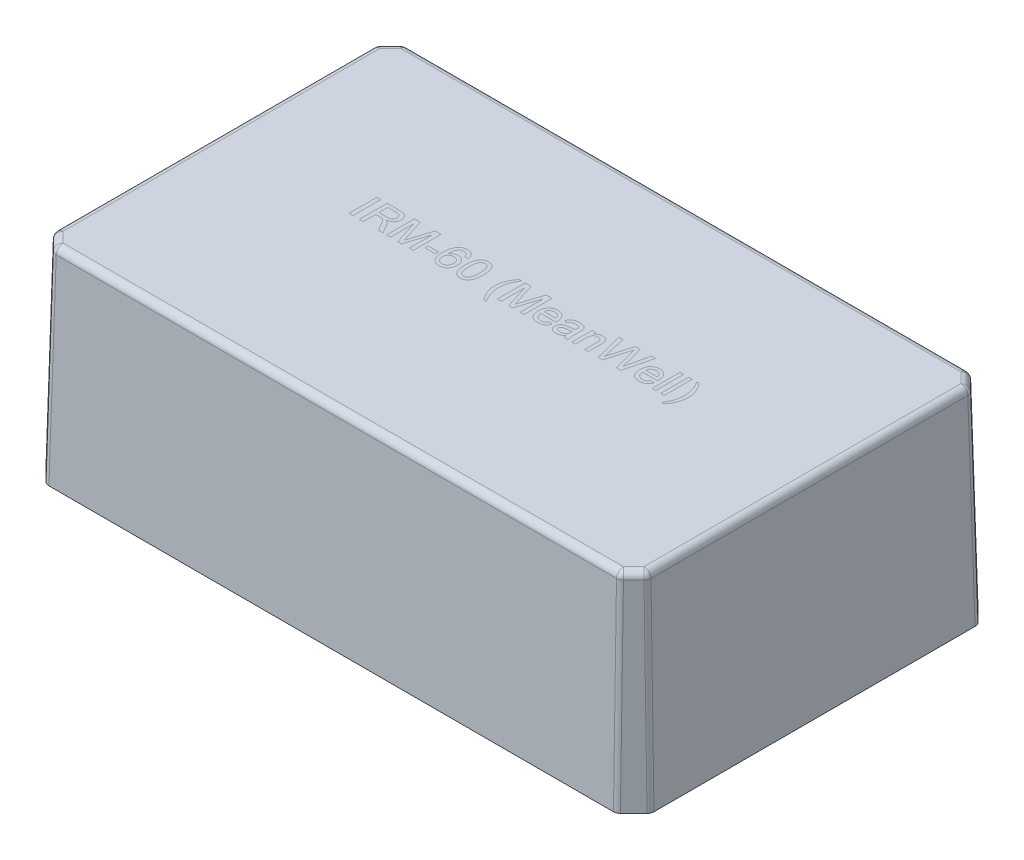
from build123d import *

# Parameters (mm, degrees)
EXTRUDE_1_DEPTH = 29.5
EXTRUDE_1_TAPER = 1.5
FILLET_1_R      = 1
SKETCH_2_R      = 1
SKETCH_2_R_2    = 0.5
EXTRUDE_2_DEPTH = 3.5
FILLET_2_R      = 0.25


with BuildPart() as part:
    # Эскиз1 → Бобышка-Вытянуть1 (new body)
    with BuildSketch(Plane(origin=(0, 0, 0), x_dir=(1, 0, 0), z_dir=(0, 1, 0))):
        Polygon((-43.5, 23.5), (-43.5, -23.5), (-41, -26), (41, -26), (43.5, -23.5), (43.5, 23.5), (41, 26), (-41, 26), align=None)
    extrude(amount=EXTRUDE_1_DEPTH, taper=EXTRUDE_1_TAPER)

    # Скругление1
    fillet_1_edges = [part.edges().sort_by_distance(p)[0] for p in [
        (43.113757657, 14.75, 23.340013183),
        (40.840013183, 14.75, 25.613757657),
        (43.113757657, 14.75, -23.340013183),
        (40.840013183, 14.75, -25.613757657),
        (-40.840013183, 14.75, -25.613757657),
        (-43.113757657, 14.75, -23.340013183),
        (-41.70377084, 29.5, -24.20377084),
        (0, 29.5, -25.227515314),
        (41.70377084, 29.5, -24.20377084),
        (42.727515314, 29.5, 0),
        (41.70377084, 29.5, 24.20377084),
        (0, 29.5, 25.227515314),
        (-42.727515314, 29.5, 0),
        (-41.70377084, 29.5, 24.20377084),
        (-43.113757657, 14.75, 23.340013183),
        (-40.840013183, 14.75, 25.613757657),
    ]]
    fillet(fillet_1_edges, radius=FILLET_1_R)

    # Эскиз2 → Бобышка-Вытянуть2 (add)
    with BuildSketch(Plane.XZ):
        with Locations((-37.8, -14.75)):
            Circle(SKETCH_2_R)
        with Locations((-37.8, -20.25)):
            Circle(SKETCH_2_R)
        with Locations((38.2, 21)):
            Circle(SKETCH_2_R_2)
        with Locations((38.2, 14.25)):
            Circle(SKETCH_2_R_2)
    extrude(amount=EXTRUDE_2_DEPTH)

    # Скругление2
    fillet_2_edges = [part.edges().sort_by_distance(p)[0] for p in [
        (37.7, -3.5, 21),
        (37.7, -3.5, 14.25),
        (-38.8, -3.5, -14.75),
        (-38.8, -3.5, -20.25),
    ]]
    fillet(fillet_2_edges, radius=FILLET_2_R)


solid = part.part
